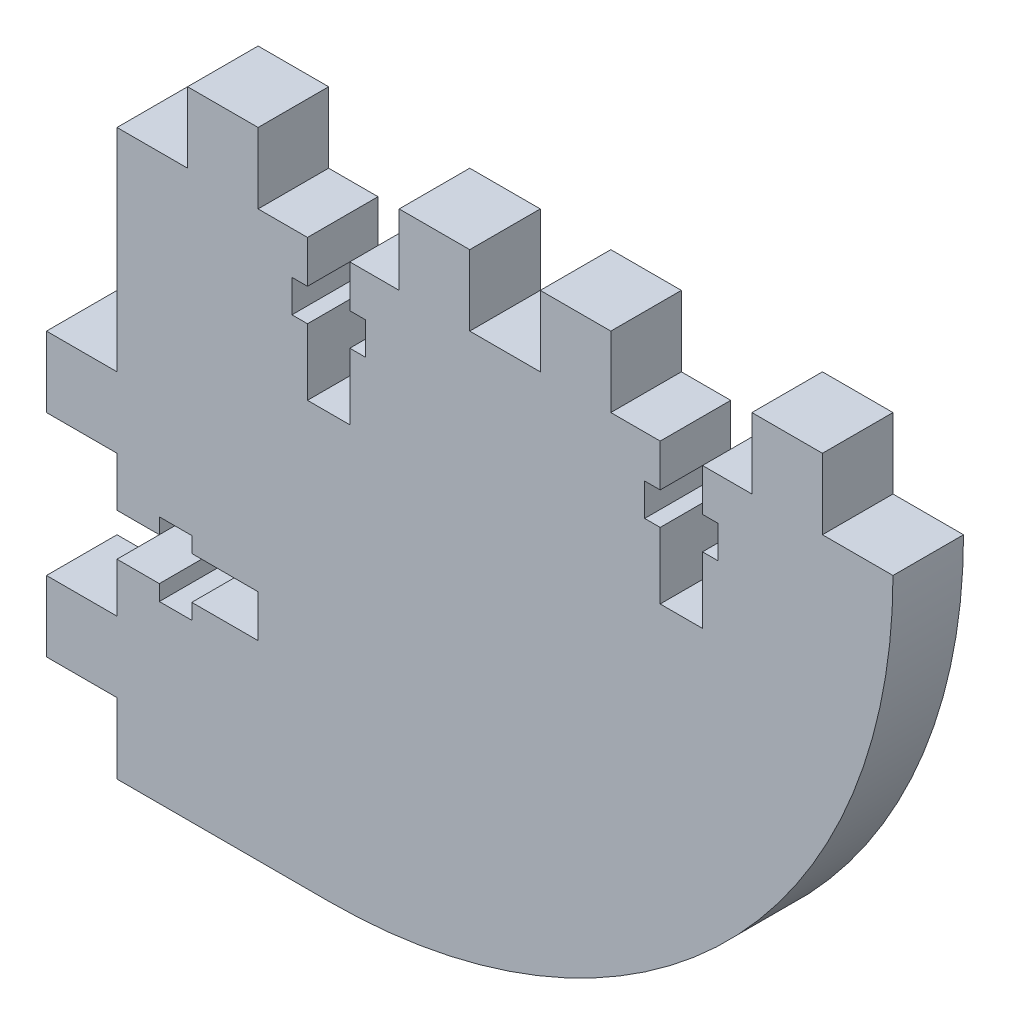
from build123d import *

# Parameters (mm, degrees)
BOSS_EXTRU_1_DEPTH = 5
CONG_1_R           = 40


with BuildPart() as part:
    # Esquisse1 → Boss.-Extru.1 (new body)
    with BuildSketch(Plane.XY):
        Polygon((0, 25), (0, 10), (-5, 10), (-5, 5), (0, 5), (0, 1.5), (3, 1.5), (3, 2.6), (5.3, 2.6), (5.3, 1.5), (10, 1.5), (10, -1.5), (5.3, -1.5), (5.3, -2.6), (3, -2.6), (3, -1.5), (0, -1.5), (0, -5), (-5, -5), (-5, -10), (0, -10), (0, -15), (55, -15), (55, 25), (50, 25), (50, 30), (45, 30), (45, 25), (41.5, 25), (41.5, 22), (42.6, 22), (42.6, 19.7), (41.5, 19.7), (41.5, 15), (38.5, 15), (38.5, 19.7), (37.4, 19.7), (37.4, 22), (38.5, 22), (38.5, 25), (35, 25), (35, 30), (30, 30), (30, 25), (25, 25), (25, 30), (20, 30), (20, 25), (16.5, 25), (16.5, 22), (17.6, 22), (17.6, 19.7), (16.5, 19.7), (16.5, 15), (13.5, 15), (13.5, 19.7), (12.4, 19.7), (12.4, 22), (13.5, 22), (13.5, 25), (10, 25), (10, 30), (5, 30), (5, 25), align=None)
    extrude(amount=BOSS_EXTRU_1_DEPTH)

    # Congé1
    cong_1_edges = [part.edges().sort_by_distance(p)[0] for p in [
        (55, -15, 2.5),
    ]]
    fillet(cong_1_edges, radius=CONG_1_R - 0.0001)  # a hair under: the kernel refuses the full size


solid = part.part
